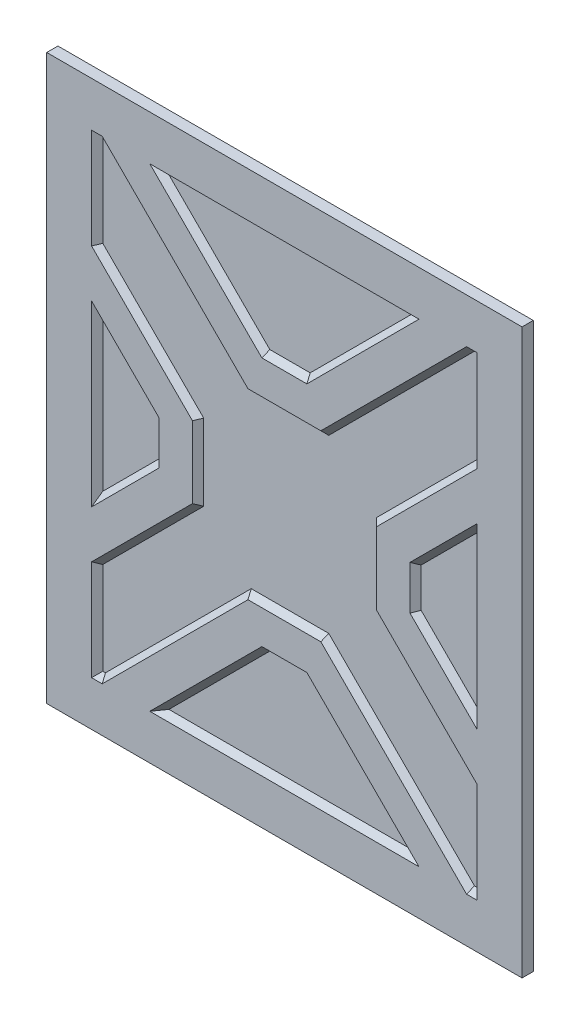
from build123d import *

# Parameters (mm, degrees)
ESQUISSE1_W             = 424
ESQUISSE1_H             = 503
BOSS_EXTRU_1_DEPTH      = 10
ENL_V_MAT_EXTRU_1_DEPTH = 5
CHANFREIN1_SIZE         = 5


with BuildPart() as part:
    # Esquisse1 → Boss.-Extru.1 (new body)
    with BuildSketch(Plane.XY):
        with Locations((212, 251.5)):
            Rectangle(ESQUISSE1_W, ESQUISSE1_H)
    extrude(amount=BOSS_EXTRU_1_DEPTH)

    # Esquisse2 → Enlèv. mat.-Extru.1 (cut)
    with BuildSketch(Plane.XY.offset(10)):
        Polygon((100, 231.923881554), (100, 271.076118446), (40, 331.076118446), (40, 171.923881554), align=None)
        Polygon((191.923881554, 363), (232.076118446, 363), (332.076118446, 463), (91.923881554, 463), align=None)
        Polygon((40, 463), (40, 373.502525317), (130, 283.502525317), (130, 219.497474683), (40, 129.497474683), (40, 40), (49.497474683, 40), (179.497474683, 170), (244.502525317, 170), (374.502525317, 40), (384, 40), (384, 129.497474683), (294, 219.497474683), (294, 283.502525317), (384, 373.502525317), (384, 463), (374.502525317, 463), (244.502525317, 333), (179.497474683, 333), (49.497474683, 463), align=None)
        Polygon((324, 231.923881554), (324, 271.076118446), (384, 331.076118446), (384, 171.923881554), align=None)
        Polygon((332.076118446, 40), (91.923881554, 40), (191.923881554, 140), (232.076118446, 140), align=None)
    extrude(amount=-ENL_V_MAT_EXTRU_1_DEPTH, mode=Mode.SUBTRACT)

    # Chanfrein1
    chanfrein1_edges = [part.edges().sort_by_distance(p)[0] for p in [
        (212, 40, 5),
        (141.923881554, 90, 5),
        (212, 140, 5),
        (282.076118446, 90, 5),
        (40, 251.5, 5),
        (70, 301.076118446, 5),
        (100, 251.5, 5),
        (70, 201.923881554, 5),
        (384, 251.5, 5),
        (354, 201.923881554, 5),
        (324, 251.5, 5),
        (354, 301.076118446, 5),
        (114.497474683, 398, 5),
        (212, 333, 5),
        (309.502525317, 398, 5),
        (379.251262658, 463, 5),
        (384, 418.251262658, 5),
        (339, 328.502525317, 5),
        (294, 251.5, 5),
        (339, 174.497474683, 5),
        (384, 84.748737342, 5),
        (379.251262658, 40, 5),
        (309.502525317, 105, 5),
        (212, 170, 5),
        (114.497474683, 105, 5),
        (44.748737342, 40, 5),
        (40, 84.748737342, 5),
        (85, 174.497474683, 5),
        (130, 251.5, 5),
        (85, 328.502525317, 5),
        (40, 418.251262658, 5),
        (44.748737342, 463, 5),
        (212, 463, 5),
        (282.076118446, 413, 5),
        (212, 363, 5),
        (141.923881554, 413, 5),
    ]]
    chamfer(chanfrein1_edges, length=CHANFREIN1_SIZE - 0.0001)  # a hair under: the kernel refuses the full size


solid = part.part
